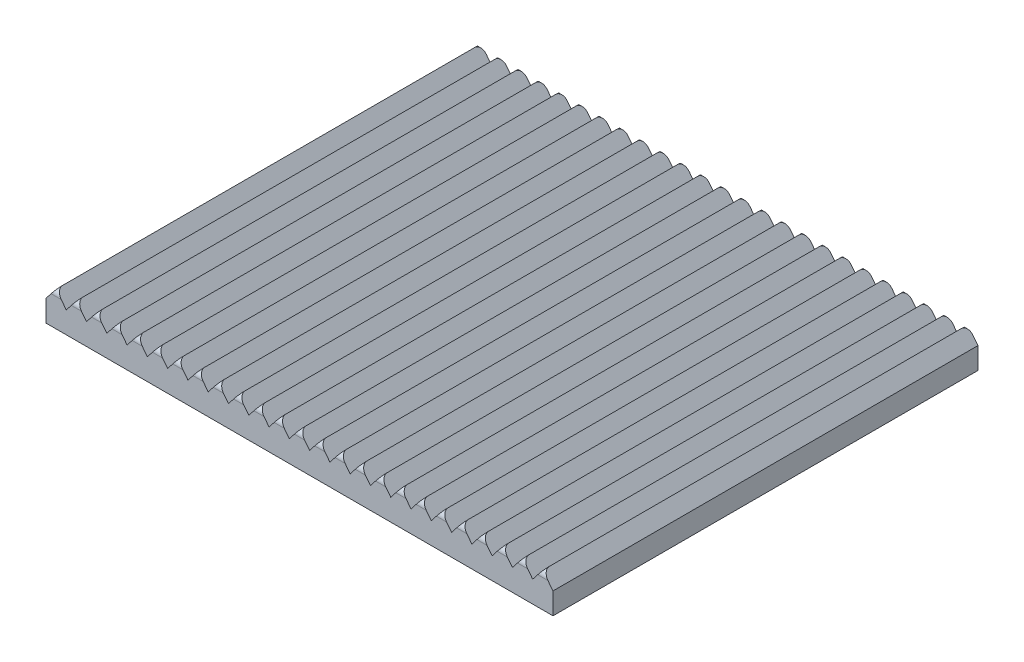
from build123d import *

# Parameters (mm, degrees)
SKETCH1_W           = 58.75
SKETCH1_H           = 49.25
SKETCH1_R           = 3.05
BOSS_EXTRUDE1_DEPTH = 1.5
BOSS_EXTRUDE2_DEPTH = 49.25
CUT_EXTRUDE1_DEPTH  = 2
CUT_EXTRUDE3_DEPTH  = 64.827526389
CHAMFER3_SIZE       = 2


with BuildPart() as part:
    # Sketch1 → Boss-Extrude1 (new body)
    with BuildSketch(Plane(origin=(0, 0, 0), x_dir=(1, 0, 0), z_dir=(0, 1, 0))):
        Rectangle(SKETCH1_W, SKETCH1_H)
        with Locations(Location((0, 0, 0), (0, 0, 270))):
            Circle(SKETCH1_R, mode=Mode.SUBTRACT)
    extrude(amount=BOSS_EXTRUDE1_DEPTH)

    # Sketch2 → Boss-Extrude2 (add)
    with BuildSketch(Plane(origin=(0, 0, -24.625), x_dir=(-1, 0, 0), z_dir=(0, 0, -1))):
        Polygon((-29.375, 1.5), (29.375, 1.5), (29.375, 2.5), (28.2, 4), (27.025, 2.5), (25.85, 4), (24.675, 2.5), (23.5, 4), (22.325, 2.5), (21.15, 4), (19.975, 2.5), (18.8, 4), (17.625, 2.5), (16.45, 4), (15.275, 2.5), (14.1, 4), (12.925, 2.5), (11.75, 4), (10.575, 2.5), (9.4, 4), (8.225, 2.5), (7.05, 4), (5.875, 2.5), (4.7, 4), (3.525, 2.5), (2.35, 4), (1.175, 2.5), (0, 4), (-1.175, 2.5), (-2.35, 4), (-3.525, 2.5), (-4.7, 4), (-5.875, 2.5), (-7.05, 4), (-8.225, 2.5), (-9.4, 4), (-10.575, 2.5), (-11.75, 4), (-12.925, 2.5), (-14.1, 4), (-15.275, 2.5), (-16.45, 4), (-17.625, 2.5), (-18.8, 4), (-19.975, 2.5), (-21.15, 4), (-22.325, 2.5), (-23.5, 4), (-24.675, 2.5), (-25.85, 4), (-27.025, 2.5), (-28.2, 4), (-29.375, 2.5), align=None)
    extrude(amount=-BOSS_EXTRUDE2_DEPTH)

    # Sketch3 → Cut-Extrude1 (cut)
    with BuildSketch(Plane(origin=(0, 0, 0), x_dir=(-1, 0, 0), z_dir=(0, -1, 0))):
        with BuildLine():
            Line((-1.75, -2.497999199), (-1.75, -5))
            Line((-1.75, -5), (1.75, -5))
            Line((1.75, -5), (1.75, -2.497999199))
            ThreePointArc((1.75, -2.497999199), (0, 3.05), (-1.75, -2.497999199))
        make_face()
    extrude(amount=-CUT_EXTRUDE1_DEPTH, mode=Mode.SUBTRACT)

    # Sketch4 → Cut-Extrude3 (cut, through all)
    with BuildSketch(Plane(origin=(29.375, 0, 0), x_dir=(0, 0, -1), z_dir=(1, 0, 0))):
        with BuildLine():
            Line((-23.875, 4), (-24.625, 4))
            Line((-24.625, 4), (-24.625, 3.25))
            ThreePointArc((-24.625, 3.25), (-24.405330086, 3.780330086), (-23.875, 4))
        make_face()
    cut_extrude3 = extrude(amount=-CUT_EXTRUDE3_DEPTH, mode=Mode.SUBTRACT)

    # Mirror1: Cut-Extrude3 across plane
    add(cut_extrude3.mirror(Plane.XY), mode=Mode.SUBTRACT)

    # Chamfer3
    chamfer3_edges = [part.edges().sort_by_distance(p)[0] for p in [
        (0, 0, 5),
    ]]
    chamfer(chamfer3_edges, length=CHAMFER3_SIZE - 0.0001)  # a hair under: the kernel refuses the full size


solid = part.part
